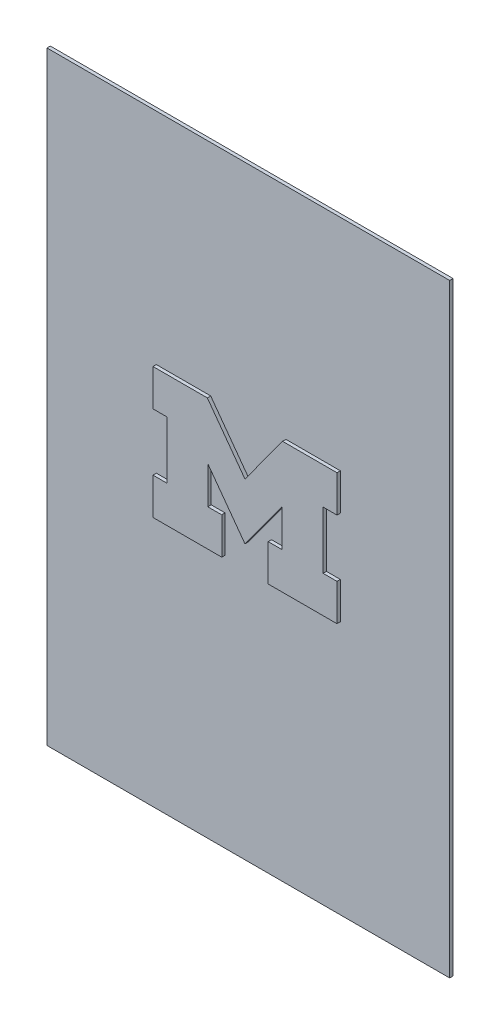
from build123d import *

# Parameters (mm, degrees)
SKETCH1_W           = 304.8
SKETCH1_H           = 457.2
BOSS_EXTRUDE1_DEPTH = 2.54
BOSS_EXTRUDE3_DEPTH = 2.54


with BuildPart() as part:
    # Sketch1 → Boss-Extrude1 (new body)
    with BuildSketch(Plane.XY):
        with Locations((152.4, 228.6)):
            Rectangle(SKETCH1_W, SKETCH1_H)
    extrude(amount=BOSS_EXTRUDE1_DEPTH)

    # Sketch3 → Boss-Extrude3 (add)
    with BuildSketch(Plane.XY.offset(2.54)):
        Polygon((93.2815, 219.874765846), (82.7659, 219.874765846), (82.7659, 192.111697441), (134.8359, 192.111697441), (134.8359, 219.874765846), (124.3203, 219.874765846), (124.3203, 248.068765846), (152.4, 209.643913215), (180.4797, 248.068765846), (180.4797, 219.874765846), (169.9641, 219.874765846), (169.9641, 192.111697441), (222.0341, 192.111697441), (222.0341, 219.874765846), (211.5185, 219.874765846), (211.5185, 263.308765846), (222.0341, 263.308765846), (222.0341, 291.071834252), (180.8861, 291.071834252), (152.4, 252.090855305), (123.9139, 291.071834252), (82.7659, 291.071834252), (82.7659, 263.308765846), (93.2815, 263.308765846), align=None)
    extrude(amount=BOSS_EXTRUDE3_DEPTH)


solid = part.part
